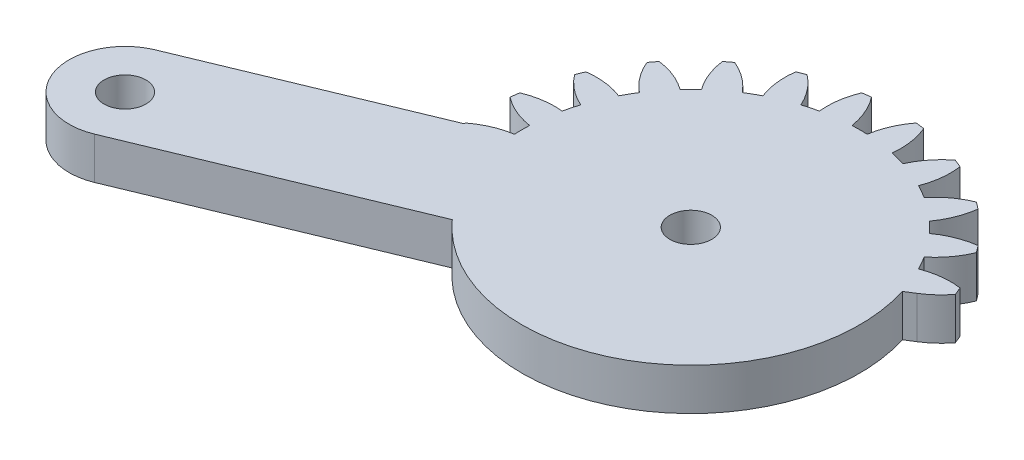
from build123d import *

# Parameters (mm, degrees)
SKETCH1_R              = 1.5
BOSS_EXTRUDE1_DEPTH    = 3
SKETCH3_R              = 1.5
BOSS_EXTRUDE2_DEPTH    = 3
CUT_EXTRUDE1_OUTLINE_R = 1.5
CUT_EXTRUDE1_DEPTH     = 3


# Read off the part's stored shape, not the designer's step: Cut-Extrude1
with BuildPart() as part:
    # Sketch1 → Boss-Extrude1 (new body)
    with BuildSketch(Plane(origin=(0, 0, 0), x_dir=(1, 0, 0), z_dir=(0, 1, 0))):
        with BuildLine():
            Line((20.643657446, 4), (2.081641936, 4))
            ThreePointArc((2.081641936, 4), (2.861028333, 4.588201733), (3.521749436, 5.30713988))
            ThreePointArc((3.521749436, 5.30713988), (3.405395609, 5.596745198), (3.282888305, 5.883801663))
            ThreePointArc((3.282888305, 5.883801663), (1.93527598, 5.894040025), (0.627094961, 5.57027124))
            ThreePointArc((0.627094961, 5.57027124), (0.366286148, 6.046375), (0.084372603, 6.510293938))
            ThreePointArc((0.084372603, 6.510293938), (1.018855105, 7.48132754), (1.683794586, 8.65351323))
            ThreePointArc((1.683794586, 8.65351323), (1.496450048, 8.903135899), (1.303821399, 9.148703928))
            ThreePointArc((1.303821399, 9.148703928), (-0.000522033, 8.809805691), (-1.180330337, 8.158486898))
            ThreePointArc((-1.180330337, 8.158486898), (-1.555477026, 8.550865528), (-1.947855656, 8.926012217))
            ThreePointArc((-1.947855656, 8.926012217), (-1.296536862, 10.105820521), (-0.957638625, 11.410163953))
            ThreePointArc((-0.957638625, 11.410163953), (-1.203206655, 11.602792602), (-1.452829324, 11.79013714))
            ThreePointArc((-1.452829324, 11.79013714), (-2.625015014, 11.125197659), (-3.596048616, 10.190715157))
            ThreePointArc((-3.596048616, 10.190715157), (-4.059967554, 10.472628702), (-4.536071314, 10.733437515))
            ThreePointArc((-4.536071314, 10.733437515), (-4.212302529, 12.041618533), (-4.222540891, 13.389230859))
            ThreePointArc((-4.222540891, 13.389230859), (-4.509597355, 13.511738163), (-4.799202674, 13.62809199))
            ThreePointArc((-4.799202674, 13.62809199), (-5.759348103, 12.682425791), (-6.455432668, 11.528463019))
            ThreePointArc((-6.455432668, 11.528463019), (-6.976508546, 11.680699536), (-7.503891752, 11.809396783))
            ThreePointArc((-7.503891752, 11.809396783), (-7.529737283, 13.156800143), (-7.888414517, 14.455843809))
            ThreePointArc((-7.888414517, 14.455843809), (-8.197396993, 14.499881098), (-8.507248835, 14.537314892))
            ThreePointArc((-8.507248835, 14.537314892), (-9.18992168, 13.375367565), (-9.563620196, 12.080565177))
            ThreePointArc((-9.563620196, 12.080565177), (-10.106342554, 12.09275), (-10.649064912, 12.080565177))
            ThreePointArc((-10.649064912, 12.080565177), (-11.022763428, 13.375367565), (-11.705436272, 14.537314892))
            ThreePointArc((-11.705436272, 14.537314892), (-12.015288115, 14.499881098), (-12.324270591, 14.455843809))
            ThreePointArc((-12.324270591, 14.455843809), (-12.682947825, 13.156800143), (-12.708793355, 11.809396783))
            ThreePointArc((-12.708793355, 11.809396783), (-13.236176561, 11.680699536), (-13.757252439, 11.528463019))
            ThreePointArc((-13.757252439, 11.528463019), (-14.453337005, 12.682425791), (-15.413482434, 13.62809199))
            ThreePointArc((-15.413482434, 13.62809199), (-15.703087752, 13.511738163), (-15.990144217, 13.389230859))
            ThreePointArc((-15.990144217, 13.389230859), (-16.000382579, 12.041618533), (-15.676613793, 10.733437515))
            ThreePointArc((-15.676613793, 10.733437515), (-16.152717554, 10.472628702), (-16.616636492, 10.190715157))
            ThreePointArc((-16.616636492, 10.190715157), (-17.587670094, 11.125197659), (-18.759855783, 11.79013714))
            ThreePointArc((-18.759855783, 11.79013714), (-19.009478453, 11.602792602), (-19.255046482, 11.410163953))
            ThreePointArc((-19.255046482, 11.410163953), (-18.916148245, 10.105820521), (-18.264829452, 8.926012217))
            ThreePointArc((-18.264829452, 8.926012217), (-18.657208082, 8.550865528), (-19.032354771, 8.158486898))
            ThreePointArc((-19.032354771, 8.158486898), (-20.212163074, 8.809805691), (-21.516506507, 9.148703928))
            ThreePointArc((-21.516506507, 9.148703928), (-21.709135156, 8.903135899), (-21.896479694, 8.65351323))
            ThreePointArc((-21.896479694, 8.65351323), (-21.231540213, 7.48132754), (-20.297057711, 6.510293938))
            ThreePointArc((-20.297057711, 6.510293938), (-20.578971255, 6.046375), (-20.839780068, 5.57027124))
            ThreePointArc((-20.839780068, 5.57027124), (-22.147961087, 5.894040025), (-23.495573413, 5.883801663))
            ThreePointArc((-23.495573413, 5.883801663), (-23.618080717, 5.596745198), (-23.734434544, 5.30713988))
            ThreePointArc((-23.734434544, 5.30713988), (-22.788768345, 4.346994451), (-21.634805572, 3.650909885))
            ThreePointArc((-21.634805572, 3.650909885), (-21.78704209, 3.129834008), (-21.915739337, 2.602450802))
            ThreePointArc((-21.915739337, 2.602450802), (-23.263142697, 2.576605271), (-24.562186363, 2.217928037))
            ThreePointArc((-24.562186363, 2.217928037), (-24.606223651, 1.908945561), (-24.643657446, 1.599093719))
            ThreePointArc((-24.643657446, 1.599093719), (-23.481710119, 0.916420874), (-22.186907731, 0.542722358))
            ThreePointArc((-22.186907731, 0.542722358), (-22.199092554, 0), (-22.186907731, -0.542722358))
            ThreePointArc((-22.186907731, -0.542722358), (-23.481710119, -0.916420874), (-24.643657446, -1.599093719))
            ThreePointArc((-24.643657446, -1.599093719), (-24.606223651, -1.908945561), (-24.562186363, -2.217928037))
            ThreePointArc((-24.562186363, -2.217928037), (-23.263142697, -2.576605271), (-21.915739337, -2.602450802))
            ThreePointArc((-21.915739337, -2.602450802), (-21.78704209, -3.129834008), (-21.634805572, -3.650909885))
            ThreePointArc((-21.634805572, -3.650909885), (-22.788768345, -4.346994451), (-23.734434544, -5.30713988))
            ThreePointArc((-23.734434544, -5.30713988), (-23.618080717, -5.596745198), (-23.495573413, -5.883801663))
            ThreePointArc((-23.495573413, -5.883801663), (-22.147961087, -5.894040025), (-20.839780068, -5.57027124))
            ThreePointArc((-20.839780068, -5.57027124), (-20.578971255, -6.046375), (-20.297057711, -6.510293938))
            ThreePointArc((-20.297057711, -6.510293938), (-21.231540213, -7.48132754), (-21.896479694, -8.65351323))
            ThreePointArc((-21.896479694, -8.65351323), (-21.709135156, -8.903135899), (-21.516506507, -9.148703928))
            ThreePointArc((-21.516506507, -9.148703928), (-20.212163074, -8.809805691), (-19.032354771, -8.158486898))
            ThreePointArc((-19.032354771, -8.158486898), (-18.657208082, -8.550865528), (-18.264829452, -8.926012217))
            ThreePointArc((-18.264829452, -8.926012217), (-18.916148245, -10.105820521), (-19.255046482, -11.410163953))
            ThreePointArc((-19.255046482, -11.410163953), (-19.009478453, -11.602792602), (-18.759855783, -11.79013714))
            ThreePointArc((-18.759855783, -11.79013714), (-17.587670094, -11.125197659), (-16.616636492, -10.190715157))
            ThreePointArc((-16.616636492, -10.190715157), (-16.152717554, -10.472628702), (-15.676613793, -10.733437515))
            ThreePointArc((-15.676613793, -10.733437515), (-16.000382579, -12.041618533), (-15.990144217, -13.389230859))
            ThreePointArc((-15.990144217, -13.389230859), (-15.703087752, -13.511738163), (-15.413482434, -13.62809199))
            ThreePointArc((-15.413482434, -13.62809199), (-14.453337005, -12.682425791), (-13.757252439, -11.528463019))
            ThreePointArc((-13.757252439, -11.528463019), (-13.236176561, -11.680699536), (-12.708793355, -11.809396783))
            ThreePointArc((-12.708793355, -11.809396783), (-12.682947825, -13.156800143), (-12.324270591, -14.455843809))
            ThreePointArc((-12.324270591, -14.455843809), (-12.015288115, -14.499881098), (-11.705436272, -14.537314892))
            ThreePointArc((-11.705436272, -14.537314892), (-11.022763428, -13.375367565), (-10.649064912, -12.080565177))
            ThreePointArc((-10.649064912, -12.080565177), (-10.106342554, -12.09275), (-9.563620196, -12.080565177))
            ThreePointArc((-9.563620196, -12.080565177), (-9.18992168, -13.375367565), (-8.507248835, -14.537314892))
            ThreePointArc((-8.507248835, -14.537314892), (-8.197396993, -14.499881098), (-7.888414517, -14.455843809))
            ThreePointArc((-7.888414517, -14.455843809), (-7.529737283, -13.156800143), (-7.503891752, -11.809396783))
            ThreePointArc((-7.503891752, -11.809396783), (-6.976508546, -11.680699536), (-6.455432668, -11.528463019))
            ThreePointArc((-6.455432668, -11.528463019), (-5.759348103, -12.682425791), (-4.799202674, -13.62809199))
            ThreePointArc((-4.799202674, -13.62809199), (-4.509597355, -13.511738163), (-4.222540891, -13.389230859))
            ThreePointArc((-4.222540891, -13.389230859), (-4.212302529, -12.041618533), (-4.536071314, -10.733437515))
            ThreePointArc((-4.536071314, -10.733437515), (-4.059967554, -10.472628702), (-3.596048616, -10.190715157))
            ThreePointArc((-3.596048616, -10.190715157), (-2.625015014, -11.125197659), (-1.452829324, -11.79013714))
            ThreePointArc((-1.452829324, -11.79013714), (-1.203206655, -11.602792602), (-0.957638625, -11.410163953))
            ThreePointArc((-0.957638625, -11.410163953), (-1.296536862, -10.105820521), (-1.947855656, -8.926012217))
            ThreePointArc((-1.947855656, -8.926012217), (-1.555477026, -8.550865528), (-1.180330337, -8.158486898))
            ThreePointArc((-1.180330337, -8.158486898), (-0.000522033, -8.809805691), (1.303821399, -9.148703928))
            ThreePointArc((1.303821399, -9.148703928), (1.496450048, -8.903135899), (1.683794586, -8.65351323))
            ThreePointArc((1.683794586, -8.65351323), (1.018855105, -7.48132754), (0.084372603, -6.510293938))
            ThreePointArc((0.084372603, -6.510293938), (0.366286148, -6.046375), (0.627094961, -5.57027124))
            ThreePointArc((0.627094961, -5.57027124), (1.93527598, -5.894040025), (3.282888305, -5.883801663))
            ThreePointArc((3.282888305, -5.883801663), (3.405395609, -5.596745198), (3.521749436, -5.30713988))
            ThreePointArc((3.521749436, -5.30713988), (2.861028333, -4.588201733), (2.081641936, -4))
            Line((2.081641936, -4), (20.643657446, -4))
            ThreePointArc((20.643657446, -4), (24.643657446, 0), (20.643657446, 4))
        make_face()
        with Locations(Location((-10.106342554, 0, 0), (0, 0, 270))):
            Circle(SKETCH1_R, mode=Mode.SUBTRACT)
        with Locations(Location((20.643657446, 0, 0), (0, 0, 270))):
            Circle(SKETCH1_R, mode=Mode.SUBTRACT)
    extrude(amount=BOSS_EXTRUDE1_DEPTH)

    # Sketch3 → Boss-Extrude2 (add)
    with BuildSketch(Plane(origin=(0, 3, 0), x_dir=(1, 0, 0), z_dir=(0, 1, 0))):
        with BuildLine():
            Line((-14.106342554, 0), (-20.558846273, 0))
            Line((-20.558846273, 0), (-40.277341791, -8.167668273))
            ThreePointArc((-40.277341791, -8.167668273), (-42.442126192, -13.393920133), (-37.215874332, -15.558704533))
            Line((-37.215874332, -15.558704533), (-8.575608824, -3.69551813))
            ThreePointArc((-8.575608824, -3.69551813), (-12.328623486, -3.325878449), (-14.106342554, 0))
        make_face()
        with Locations(Location((-38.746608062, -11.863186403, 0), (0, 0, 270))):
            Circle(SKETCH3_R, mode=Mode.SUBTRACT)
    extrude(amount=-BOSS_EXTRUDE2_DEPTH)

    # Cut-Extrude1 outline → Cut-Extrude1 (cut)
    # profile 1 of 9: a face of its own
    with BuildSketch(Plane(origin=(0, 0, 0), x_dir=(1, 0, 0), z_dir=(0, 1, 0))):
        with BuildLine():
            Line((2.081641936, 4), (1.43808022, 3.600125745))
            ThreePointArc((1.43808022, 3.600125745), (1.939395695, -1.065266441), (0.627094961, -5.57027124))
            ThreePointArc((0.627094961, -5.57027124), (1.93527598, -5.894040025), (3.282888305, -5.883801663))
            ThreePointArc((3.282888305, -5.883801663), (3.405395609, -5.596745198), (3.521749436, -5.30713988))
            ThreePointArc((3.521749436, -5.30713988), (2.861028333, -4.588201733), (2.081641936, -4))
            Line((2.081641936, -4), (20.643657446, -4))
            ThreePointArc((20.643657446, -4), (24.643657446, 0), (20.643657446, 4))
            Line((20.643657446, 4), (2.081641936, 4))
        make_face()
        with Locations((20.643657446, 0)):
            Circle(CUT_EXTRUDE1_OUTLINE_R, mode=Mode.SUBTRACT)
    # profile 2 of 9: a face of its own
    with BuildSketch(Plane(origin=(0, 0, 0), x_dir=(1, 0, 0), z_dir=(0, 1, 0))):
        with BuildLine():
            ThreePointArc((-21.516506507, -9.148703928), (-20.212163075, -8.809805691), (-19.032354771, -8.158486898))
            ThreePointArc((-19.032354771, -8.158486898), (-19.075783612, -8.110716964), (-19.118956803, -8.062715855))
            Line((-19.118956803, -8.062715855), (-21.572155055, -9.078863843))
            ThreePointArc((-21.572155055, -9.078863843), (-21.544384086, -9.113826359), (-21.516506507, -9.148703928))
        make_face()
    # profile 3 of 9: a face of its own
    with BuildSketch(Plane(origin=(0, 0, 0), x_dir=(1, 0, 0), z_dir=(0, 1, 0))):
        with BuildLine():
            ThreePointArc((-18.759855783, -11.79013714), (-17.587670094, -11.125197659), (-16.616636492, -10.190715157))
            ThreePointArc((-16.616636492, -10.190715157), (-17.467942325, -9.593823606), (-18.264829452, -8.926012217))
            ThreePointArc((-18.264829452, -8.926012217), (-18.916148245, -10.105820521), (-19.255046482, -11.410163953))
            ThreePointArc((-19.255046482, -11.410163953), (-19.009478453, -11.602792602), (-18.759855783, -11.79013714))
        make_face()
    # profile 4 of 9: a face of its own
    with BuildSketch(Plane(origin=(0, 0, 0), x_dir=(1, 0, 0), z_dir=(0, 1, 0))):
        with BuildLine():
            ThreePointArc((-15.413482434, -13.62809199), (-14.453337005, -12.682425791), (-13.757252439, -11.528463019))
            ThreePointArc((-13.757252439, -11.528463019), (-14.73403763, -11.172244217), (-15.676613793, -10.733437515))
            ThreePointArc((-15.676613793, -10.733437515), (-16.000382579, -12.041618533), (-15.990144217, -13.389230859))
            ThreePointArc((-15.990144217, -13.389230859), (-15.703087752, -13.511738163), (-15.413482434, -13.62809199))
        make_face()
    # profile 5 of 9: a face of its own
    with BuildSketch(Plane(origin=(0, 0, 0), x_dir=(1, 0, 0), z_dir=(0, 1, 0))):
        with BuildLine():
            ThreePointArc((-11.705436272, -14.537314892), (-11.022763428, -13.375367565), (-10.649064912, -12.080565177))
            ThreePointArc((-10.649064912, -12.080565177), (-11.684763165, -11.989294847), (-12.708793355, -11.809396783))
            ThreePointArc((-12.708793355, -11.809396783), (-12.682947825, -13.156800143), (-12.324270591, -14.455843809))
            ThreePointArc((-12.324270591, -14.455843809), (-12.015288115, -14.499881098), (-11.705436272, -14.537314892))
        make_face()
    # profile 6 of 9: a face of its own
    with BuildSketch(Plane(origin=(0, 0, 0), x_dir=(1, 0, 0), z_dir=(0, 1, 0))):
        with BuildLine():
            ThreePointArc((-7.888414517, -14.455843809), (-7.529737283, -13.156800143), (-7.503891752, -11.809396783))
            ThreePointArc((-7.503891752, -11.809396783), (-8.527921943, -11.989294847), (-9.563620196, -12.080565177))
            ThreePointArc((-9.563620196, -12.080565177), (-9.18992168, -13.375367565), (-8.507248835, -14.537314892))
            ThreePointArc((-8.507248835, -14.537314892), (-8.197396993, -14.499881098), (-7.888414517, -14.455843809))
        make_face()
    # profile 7 of 9: a face of its own
    with BuildSketch(Plane(origin=(0, 0, 0), x_dir=(1, 0, 0), z_dir=(0, 1, 0))):
        with BuildLine():
            ThreePointArc((-4.222540891, -13.389230859), (-4.212302529, -12.041618534), (-4.536071314, -10.733437515))
            ThreePointArc((-4.536071314, -10.733437515), (-5.478647477, -11.172244217), (-6.455432668, -11.528463019))
            ThreePointArc((-6.455432668, -11.528463019), (-5.759348103, -12.682425792), (-4.799202674, -13.62809199))
            ThreePointArc((-4.799202674, -13.62809199), (-4.509597356, -13.511738163), (-4.222540891, -13.389230859))
        make_face()
    # profile 8 of 9: a face of its own
    with BuildSketch(Plane(origin=(0, 0, 0), x_dir=(1, 0, 0), z_dir=(0, 1, 0))):
        with BuildLine():
            ThreePointArc((-0.957638625, -11.410163953), (-1.296536862, -10.105820521), (-1.947855656, -8.926012217))
            ThreePointArc((-1.947855656, -8.926012217), (-2.744742783, -9.593823606), (-3.596048616, -10.190715157))
            ThreePointArc((-3.596048616, -10.190715157), (-2.625015014, -11.125197659), (-1.452829324, -11.79013714))
            ThreePointArc((-1.452829324, -11.79013714), (-1.203206654, -11.602792602), (-0.957638625, -11.410163953))
        make_face()
    # profile 9 of 9: a face of its own
    with BuildSketch(Plane(origin=(0, 0, 0), x_dir=(1, 0, 0), z_dir=(0, 1, 0))):
        with BuildLine():
            ThreePointArc((1.683794586, -8.65351323), (1.018855105, -7.48132754), (0.084372603, -6.510293938))
            ThreePointArc((0.084372603, -6.510293938), (-0.512518948, -7.361599771), (-1.180330337, -8.158486898))
            ThreePointArc((-1.180330337, -8.158486898), (-0.000522033, -8.809805691), (1.303821399, -9.148703928))
            ThreePointArc((1.303821399, -9.148703928), (1.496450048, -8.903135899), (1.683794586, -8.65351323))
        make_face()
    extrude(amount=CUT_EXTRUDE1_DEPTH, mode=Mode.SUBTRACT)


solid = part.part
